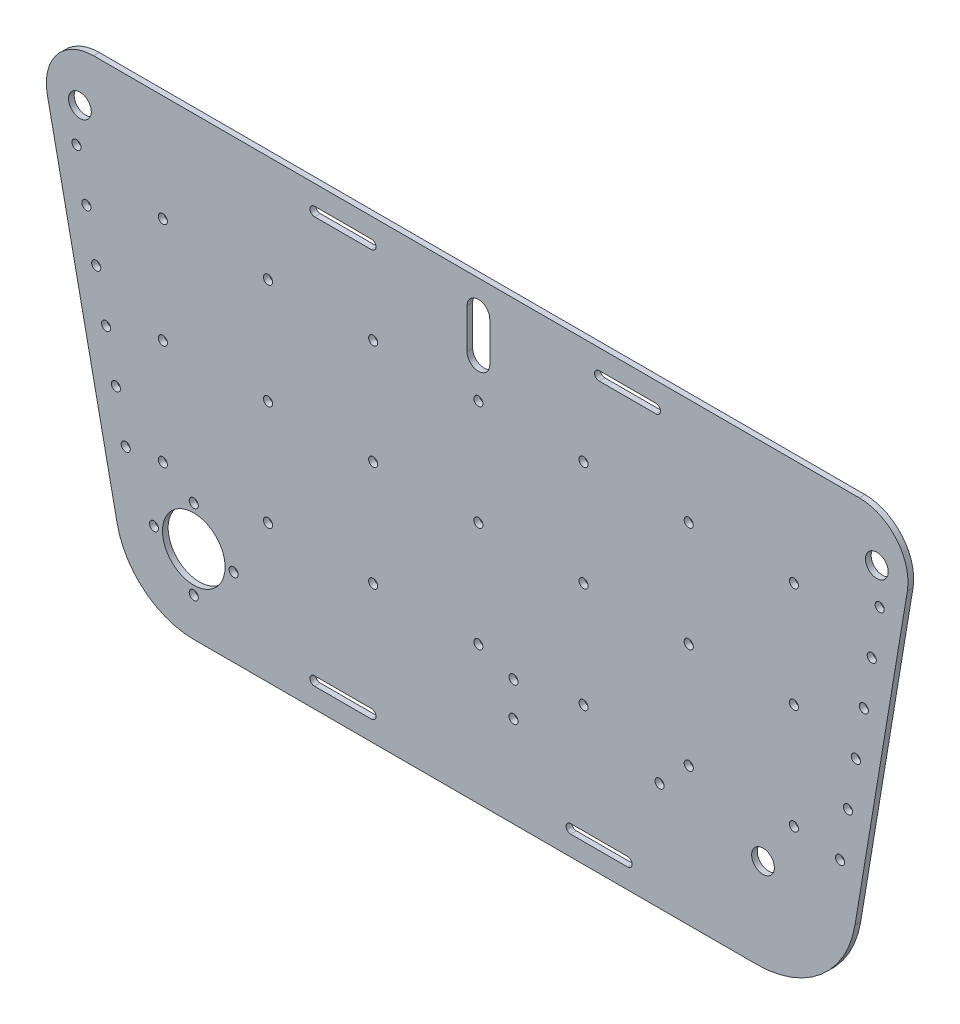
from build123d import *

# Parameters (mm, degrees)
SKETCH3_R           = 1.6
SKETCH3_R_2         = 11
SKETCH3_R_3         = 4
BOSS_EXTRUDE1_DEPTH = 2
CUT_EXTRUDE3_DEPTH  = 202.525833861
SKETCH7_R           = 1.6
CUT_EXTRUDE4_DEPTH  = 202.525833861


with BuildPart() as part:
    # Sketch3 → Boss-Extrude1 (new body)
    with BuildSketch(Plane.XY):
        with BuildLine():
            ThreePointArc((-126.925740619, -5.558827984), (-117.356688592, -21.298876537), (-100, -27.468256266))
            Line((-100, -27.468256266), (97.771410342, -27.468256266))
            ThreePointArc((97.771410342, -27.468256266), (120.43275171, -19.155269629), (132.342869895, 1.839758932))
            Line((132.342869895, 1.839758932), (150.718078468, 112.587537538))
            ThreePointArc((150.718078468, 112.587537538), (146.883625567, 126.475757693), (133.810342842, 132.531743734))
            Line((133.810342842, 132.531743734), (-135.227817714, 132.531743734))
            ThreePointArc((-135.227817714, 132.531743734), (-148.084116861, 126.418210974), (-151.456383586, 112.587537538))
            Line((-151.456383586, 112.587537538), (-126.925740619, -5.558827984))
        make_face()
        with Locations((-100, -13.968256266)):
            Circle(SKETCH3_R, mode=Mode.SUBTRACT)
        with Locations((-114, 0.031743734)):
            Circle(SKETCH3_R, mode=Mode.SUBTRACT)
        with Locations((-100, 0.031743734)):
            Circle(SKETCH3_R_2, mode=Mode.SUBTRACT)
        with Locations((-86, 0.031743734)):
            Circle(SKETCH3_R, mode=Mode.SUBTRACT)
        with Locations((-100, 14.031743734)):
            Circle(SKETCH3_R, mode=Mode.SUBTRACT)
        with Locations((12.357913989, 4.531743734)):
            Circle(SKETCH3_R, mode=Mode.SUBTRACT)
        with Locations((63.65613527, 10.531743734)):
            Circle(SKETCH3_R, mode=Mode.SUBTRACT)
        with Locations((100, 5.031743734)):
            Circle(SKETCH3_R_3, mode=Mode.SUBTRACT)
        with Locations((12.357913989, 16.531743734)):
            Circle(SKETCH3_R, mode=Mode.SUBTRACT)
        with Locations((-140, 115.061965544)):
            Circle(SKETCH3_R_3, mode=Mode.SUBTRACT)
        with BuildLine():
            Line((-4, 115.061965561), (-4, 121.990168775))
            ThreePointArc((-4, 121.990168775), (0, 125.990168775), (4, 121.990168775))
            Line((4, 121.990168775), (4, 115.061965544))
            Line((4, 115.061965544), (4, 108.133762314))
            ThreePointArc((4, 108.133762314), (0, 104.133762314), (-4, 108.133762314))
            Line((-4, 108.133762314), (-4, 115.061965561))
        make_face(mode=Mode.SUBTRACT)
        with Locations((140, 115.061965544)):
            Circle(SKETCH3_R_3, mode=Mode.SUBTRACT)
    extrude(amount=BOSS_EXTRUDE1_DEPTH)

    # Sketch6 → Cut-Extrude3 (cut, through all)
    with BuildSketch(Plane.XY):
        with BuildLine():
            Line((-57.58, -17.298256266), (-37.58, -17.298256266))
            ThreePointArc((-37.58, -17.298256266), (-35.98, -18.898256266), (-37.58, -20.498256266))
            Line((-37.58, -20.498256266), (-57.58, -20.498256266))
            ThreePointArc((-57.58, -20.498256266), (-59.18, -18.898256266), (-57.58, -17.298256266))
        make_face()
        with BuildLine():
            Line((32.42, -17.298256266), (52.42, -17.298256266))
            ThreePointArc((52.42, -17.298256266), (54.02, -18.898256266), (52.42, -20.498256266))
            Line((52.42, -20.498256266), (32.42, -20.498256266))
            ThreePointArc((32.42, -20.498256266), (30.82, -18.898256266), (32.42, -17.298256266))
        make_face()
        with BuildLine():
            Line((-57.58, 125.561743734), (-37.58, 125.561743734))
            ThreePointArc((-37.58, 125.561743734), (-35.98, 123.961743734), (-37.58, 122.361743734))
            Line((-37.58, 122.361743734), (-57.58, 122.361743734))
            ThreePointArc((-57.58, 122.361743734), (-59.18, 123.961743734), (-57.58, 125.561743734))
        make_face()
        with BuildLine():
            Line((42.42, 125.561743734), (62.42, 125.561743734))
            ThreePointArc((62.42, 125.561743734), (64.02, 123.961743734), (62.42, 122.361743734))
            Line((62.42, 122.361743734), (42.42, 122.361743734))
            ThreePointArc((42.42, 122.361743734), (40.82, 123.961743734), (42.42, 125.561743734))
        make_face()
    extrude(amount=CUT_EXTRUDE3_DEPTH, mode=Mode.SUBTRACT)

    # Sketch7 → Cut-Extrude4 (cut, through all)
    with BuildSketch(Plane.XY.offset(2)):
        with Locations((-110.862196782, 95.074335332)):
            Circle(SKETCH7_R)
        with Locations((-73.908131188, 95.074335332)):
            Circle(SKETCH7_R)
        with Locations((-36.954065594, 95.074335332)):
            Circle(SKETCH7_R)
        with Locations((0, 95.074335332)):
            Circle(SKETCH7_R)
        with Locations((36.954065594, 95.074335332)):
            Circle(SKETCH7_R)
        with Locations((73.908131188, 95.074335332)):
            Circle(SKETCH7_R)
        with Locations((110.862196782, 95.074335332)):
            Circle(SKETCH7_R)
        with Locations((-73.908131188, 58.074335332)):
            Circle(SKETCH7_R)
        with Locations((-36.954065594, 58.074335332)):
            Circle(SKETCH7_R)
        with Locations((0, 58.074335332)):
            Circle(SKETCH7_R)
        with Locations((36.954065594, 58.074335332)):
            Circle(SKETCH7_R)
        with Locations((73.908131188, 58.074335332)):
            Circle(SKETCH7_R)
        with Locations((110.862196782, 58.074335332)):
            Circle(SKETCH7_R)
        with Locations((-73.908131188, 21.074335332)):
            Circle(SKETCH7_R)
        with Locations((-36.954065594, 21.074335332)):
            Circle(SKETCH7_R)
        with Locations((0, 21.074335332)):
            Circle(SKETCH7_R)
        with Locations((36.954065594, 21.074335332)):
            Circle(SKETCH7_R)
        with Locations((73.908131188, 21.074335332)):
            Circle(SKETCH7_R)
        with Locations((110.862196782, 21.074335332)):
            Circle(SKETCH7_R)
        with Locations((-110.862196782, 58.074335332)):
            Circle(SKETCH7_R)
        with Locations((-110.862196782, 21.074335332)):
            Circle(SKETCH7_R)
        with Locations((-141.184392471, 102.466753609)):
            Circle(SKETCH7_R)
        with Locations((-137.728402681, 85.821750317)):
            Circle(SKETCH7_R)
        with Locations((-134.272412891, 69.176747026)):
            Circle(SKETCH7_R)
        with Locations((-130.816423102, 52.531743734)):
            Circle(SKETCH7_R)
        with Locations((-127.360433312, 35.886740443)):
            Circle(SKETCH7_R)
        with Locations((-123.904443522, 19.241737151)):
            Circle(SKETCH7_R)
        with Locations((140.992053056, 102.843917034)):
            Circle(SKETCH7_R)
        with Locations((138.209463976, 86.0731926)):
            Circle(SKETCH7_R)
        with Locations((135.426874896, 69.302468167)):
            Circle(SKETCH7_R)
        with Locations((132.644285816, 52.531743734)):
            Circle(SKETCH7_R)
        with Locations((129.861696736, 35.761019301)):
            Circle(SKETCH7_R)
        with Locations((127.079107656, 18.990294868)):
            Circle(SKETCH7_R)
    extrude(amount=-CUT_EXTRUDE4_DEPTH, mode=Mode.SUBTRACT)


solid = part.part
